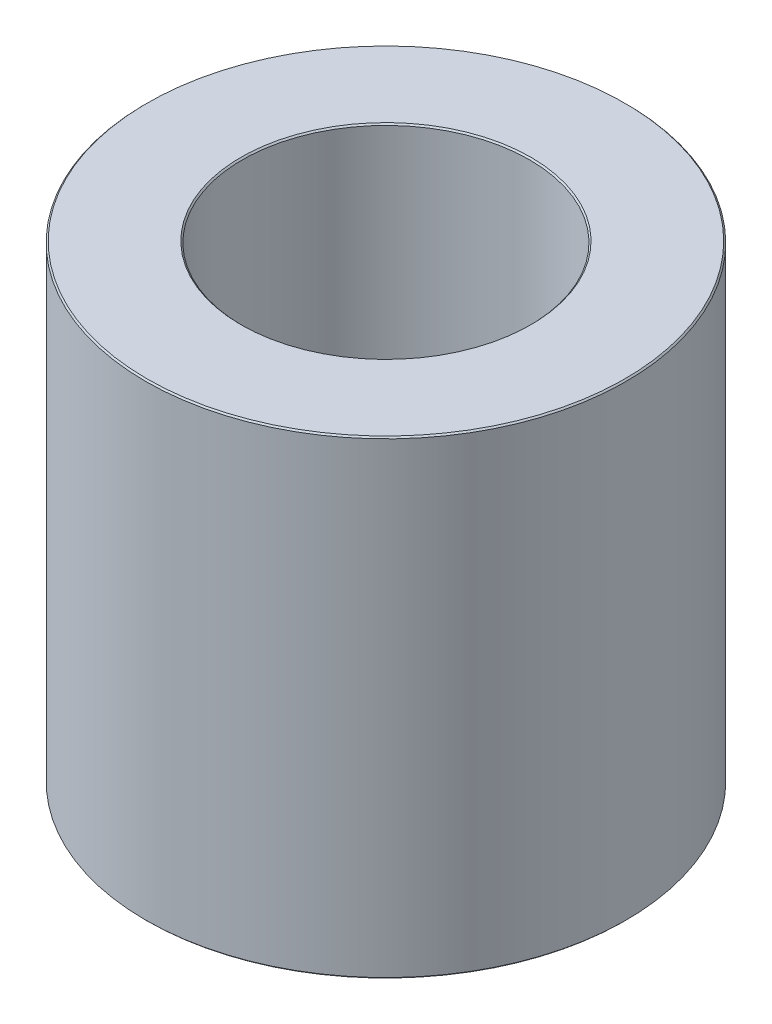
from build123d import *

# Parameters (mm, degrees)
SKETCH1_R           = 40
BOSS_EXTRUDE1_DEPTH = 78.145080905
SKETCH2_R           = 23.907346724
CUT_EXTRUDE1_DEPTH  = 97.470999112
CHAMFER1_SIZE       = 0.239085268


with BuildPart() as part:
    # Sketch1 → Boss-Extrude1 (new body)
    with BuildSketch(Plane(origin=(0, 0, 0), x_dir=(1, 0, 0), z_dir=(0, 1, 0))):
        Circle(SKETCH1_R)
    extrude(amount=BOSS_EXTRUDE1_DEPTH)

    # Sketch2 → Cut-Extrude1 (cut, through all)
    with BuildSketch(Plane(origin=(0, 0, 0), x_dir=(1, 0, 0), z_dir=(0, 1, 0))):
        Circle(SKETCH2_R)
    extrude(amount=CUT_EXTRUDE1_DEPTH, mode=Mode.SUBTRACT)

    # Chamfer1
    chamfer1_edges = [part.edges().sort_by_distance(p)[0] for p in [
        (-23.907346724, 78.145080905, 0),
        (-23.907346724, 0, 0),
        (-40, 0, 0),
        (-40, 78.145080905, 0),
    ]]
    chamfer(chamfer1_edges, length=CHAMFER1_SIZE)


solid = part.part
